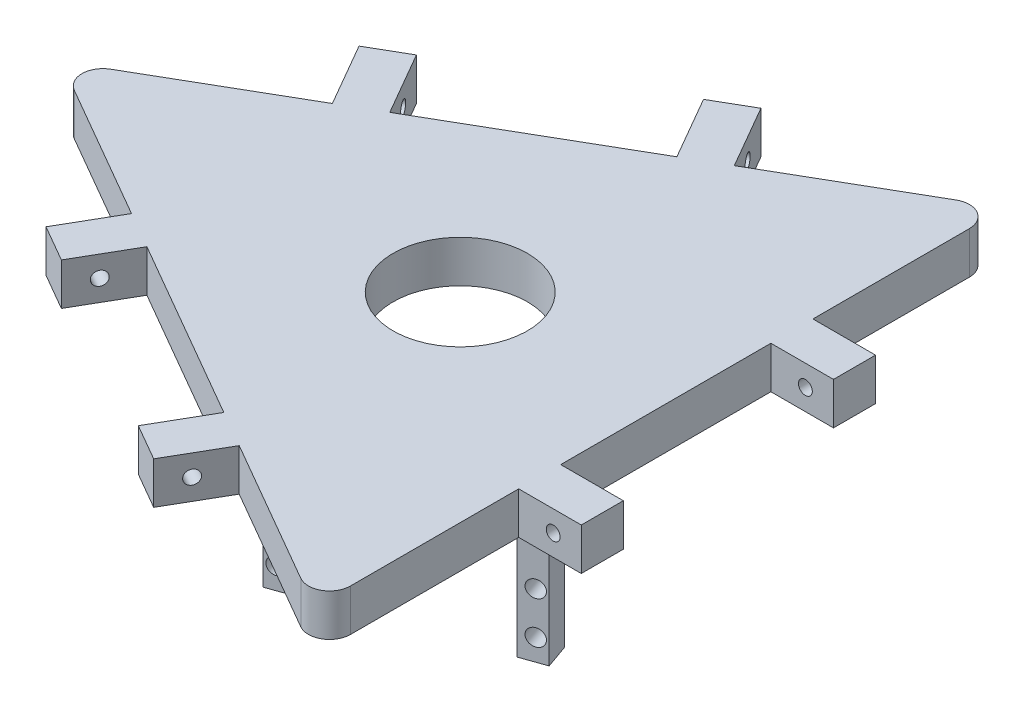
from build123d import *

# Parameters (mm, degrees)
BOSS_EXTRUDE1_DEPTH               = 10
BOSS_EXTRUDE3_DEPTH               = 10
TAP_DRILL_FOR_M4_TAP1_D           = 3.3
TAP_DRILL_FOR_M4_TAP1_CSINK_D     = 3.35
TAP_DRILL_FOR_M4_TAP1_CSINK_ANGLE = 90
CIRPATTERN1_OUTLINE_W             = 0.025
CIRPATTERN1_OUTLINE_H             = 10
CIRPATTERN1_START                 = -36.401802592
CIRPATTERN1_2_OUTLINE_W           = 14.892514764
CIRPATTERN1_2_OUTLINE_H           = 10
CIRPATTERN1_2_OUTLINE_R           = 1.675
CIRPATTERN1_2_DEPTH               = 10
CIRPATTERN1_START_2               = 23.598197408
CIRPATTERN1_3_OUTLINE_W           = 14.892514764
CIRPATTERN1_3_OUTLINE_H           = 10
CIRPATTERN1_3_OUTLINE_R           = 1.675
CIRPATTERN1_3_DEPTH               = 10
CIRPATTERN1_4_OUTLINE_R           = 1.675
CIRPATTERN1_4_DEPTH               = 1.140104786
CIRPATTERN1_5_OUTLINE_W           = 14.892514764
CIRPATTERN1_5_OUTLINE_H           = 10
CIRPATTERN1_5_OUTLINE_R           = 1.65
CIRPATTERN1_5_DEPTH               = 10
CIRPATTERN1_6_OUTLINE_W           = 14.892514764
CIRPATTERN1_6_OUTLINE_H           = 10
CIRPATTERN1_6_OUTLINE_R           = 1.65
CIRPATTERN1_6_DEPTH               = 10
SKETCH13_R                        = 15.980929879
CUT_EXTRUDE1_DEPTH                = 120.91610231
BOSS_EXTRUDE4_DEPTH               = 29
SKETCH16_R                        = 2
CUT_EXTRUDE2_DEPTH                = 6
SKETCH17_R                        = 2
CUT_EXTRUDE3_DEPTH                = 6


with BuildPart() as part:
    # Sketch2 → Boss-Extrude1 (new body)
    with BuildSketch(Plane(origin=(0, 0, 0), x_dir=(0, 0, -1), z_dir=(0, 1, 0))):
        with BuildLine():
            Line((-58.63620668, -6.560889132), (-77.942286341, -40))
            ThreePointArc((-77.942286341, -40), (-77.942286341, -45), (-73.612159322, -47.5))
            Line((-73.612159322, -47.5), (-35, -47.5))
            Line((-35, -47.5), (-25, -47.5))
            Line((-25, -47.5), (25, -47.5))
            Line((25, -47.5), (35, -47.5))
            Line((35, -47.5), (73.612159322, -47.5))
            ThreePointArc((73.612159322, -47.5), (77.942286341, -45), (77.942286341, -40))
            Line((77.942286341, -40), (58.63620668, -6.560889132))
            Line((58.63620668, -6.560889132), (53.63620668, 2.099364905))
            Line((53.63620668, 2.099364905), (28.63620668, 45.400635095))
            Line((28.63620668, 45.400635095), (23.63620668, 54.060889132))
            Line((23.63620668, 54.060889132), (4.330127019, 87.5))
            ThreePointArc((4.330127019, 87.5), (0, 90), (-4.330127019, 87.5))
            Line((-4.330127019, 87.5), (-23.63620668, 54.060889132))
            Line((-23.63620668, 54.060889132), (-28.63620668, 45.400635095))
            Line((-28.63620668, 45.400635095), (-53.63620668, 2.099364905))
            Line((-53.63620668, 2.099364905), (-58.63620668, -6.560889132))
        make_face()
    extrude(amount=BOSS_EXTRUDE1_DEPTH)

    # Sketch2<7> → Boss-Extrude3 (add)
    with BuildSketch(Plane(origin=(0, 0, 0), x_dir=(0, 0, -1), z_dir=(0, 1, 0))):
        Polygon((58.63620668, -6.560889132), (53.63620668, 2.099364905), (68.63620668, 10.759618943), (73.63620668, 2.099364905), align=None)
        Polygon((23.63620668, 54.060889132), (38.63620668, 62.72114317), (43.63620668, 54.060889132), (28.63620668, 45.400635095), align=None)
    extrude(amount=BOSS_EXTRUDE3_DEPTH)

    # Tap Drill for M4 Tap1 (through all)
    with Locations(Plane(origin=(-30.310889132, 0, 17.5), x_dir=(0.49999999999999517, 0, 0.8660254037844415), z_dir=(-0.8660254037844414, 0, 0.4999999999999951))):
        with Locations((-56.160254038, 5)):
            CounterSinkHole(TAP_DRILL_FOR_M4_TAP1_D / 2, TAP_DRILL_FOR_M4_TAP1_CSINK_D / 2, counter_sink_angle=TAP_DRILL_FOR_M4_TAP1_CSINK_ANGLE)



with BuildPart() as body_2:
    # CirPattern1: read off the stored shape, not the designer's step
    # CirPattern1 outline → CirPattern1 (revolve)
    with BuildSketch(Plane(origin=(55.706980142, 5, 0), x_dir=(1, 0, 0), z_dir=(0, -1, 0))):
        with Locations((1.6625, 28.598197408)):
            Rectangle(CIRPATTERN1_OUTLINE_W, CIRPATTERN1_OUTLINE_H)
        Polygon((1.675, -26.401802592), (1.65, -26.401802592), (1.65, -35.236697806), (1.675, -35.261697806), align=None)
    revolve(axis=Axis((55.706980142, 5, 0), (0, 0, 1)))


with BuildPart() as part_1:
    add(part.part)

    add(body_2.part)  # CirPattern1 2 merges body 2
    # CirPattern1 2 outline → CirPattern1 2 (add)
    with BuildSketch(Plane.XY.offset(CIRPATTERN1_START)):
        with Locations((54.946257382, 5)):
            Rectangle(CIRPATTERN1_2_OUTLINE_W, CIRPATTERN1_2_OUTLINE_H)
        with Locations((55.706980142, 5)):
            Circle(CIRPATTERN1_2_OUTLINE_R, mode=Mode.SUBTRACT)
    extrude(amount=CIRPATTERN1_2_DEPTH)

    # CirPattern1 3 outline → CirPattern1 3 (add)
    with BuildSketch(Plane.XY.offset(CIRPATTERN1_START_2)):
        with Locations((54.946257382, 5)):
            Rectangle(CIRPATTERN1_3_OUTLINE_W, CIRPATTERN1_3_OUTLINE_H)
        with Locations((55.706980142, 5)):
            Circle(CIRPATTERN1_3_OUTLINE_R, mode=Mode.SUBTRACT)
    extrude(amount=CIRPATTERN1_3_DEPTH)

    # CirPattern1 4 outline → CirPattern1 4 (add)
    with BuildSketch(Plane.XY.offset(CIRPATTERN1_START)):
        with Locations((55.706980142, 5)):
            Circle(CIRPATTERN1_4_OUTLINE_R)
    extrude(amount=CIRPATTERN1_4_DEPTH)

    # CirPattern1 5 outline → CirPattern1 5 (add)
    with BuildSketch(Plane(origin=(0, 0, 0), x_dir=(0.500000000000001, 0, -0.866025403784438), z_dir=(0.866025403784438, 0, 0.500000000000001)).offset(CIRPATTERN1_START)):
        with Locations((-54.946257382, 5)):
            Rectangle(CIRPATTERN1_5_OUTLINE_W, CIRPATTERN1_5_OUTLINE_H)
        with Locations((-55.706980142, 5)):
            Circle(CIRPATTERN1_5_OUTLINE_R, mode=Mode.SUBTRACT)
    extrude(amount=CIRPATTERN1_5_DEPTH)

    # CirPattern1 6 outline → CirPattern1 6 (add)
    with BuildSketch(Plane(origin=(0, 0, 0), x_dir=(0.500000000000001, 0, -0.866025403784438), z_dir=(0.866025403784438, 0, 0.500000000000001)).offset(CIRPATTERN1_START_2)):
        with Locations((-54.946257382, 5)):
            Rectangle(CIRPATTERN1_6_OUTLINE_W, CIRPATTERN1_6_OUTLINE_H)
        with Locations((-55.706980142, 5)):
            Circle(CIRPATTERN1_6_OUTLINE_R, mode=Mode.SUBTRACT)
    extrude(amount=CIRPATTERN1_6_DEPTH)

    # Sketch13 → Cut-Extrude1 (cut, through all)
    with BuildSketch(Plane.XZ):
        with Locations(Location((0.00701443, 0.012149349, 0), (0, 0, 270))):
            Circle(SKETCH13_R)
    extrude(amount=-CUT_EXTRUDE1_DEPTH, mode=Mode.SUBTRACT)

    # Sketch15 → Boss-Extrude4 (add)
    with BuildSketch(Plane.XZ):
        Polygon((-3.631756095, 39.600919679), (-3.160458196, 39.433951748), (2.023818696, 37.5973045), (4.027433875, 43.252879291), (-1.628140916, 45.25649447), align=None)
        Polygon((46.137302064, 21.969106104), (46.608599963, 21.802138173), (48.612215142, 27.457712963), (42.956640351, 29.461328142), (40.953025172, 23.805753352), align=None)
    extrude(amount=BOSS_EXTRUDE4_DEPTH)

    # Sketch16 → Cut-Extrude2 (cut)
    with BuildSketch(Plane(origin=(12.06005593, 0, 34.041740653), x_dir=(-0.9425957984699193, 0, 0.3339358631636553), z_dir=(-0.33393586316365526, 0, -0.9425957984699191))):
        with Locations((-34.152554668, -23.871092604)):
            Circle(SKETCH16_R)
        with Locations((-34.152554668, -13.871092604)):
            Circle(SKETCH16_R)
    extrude(amount=-CUT_EXTRUDE2_DEPTH, mode=Mode.SUBTRACT)

    # Sketch17 → Cut-Extrude3 (cut)
    with BuildSketch(Plane(origin=(12.06005593, 0, 34.041740653), x_dir=(-0.9425957984699224, 0, 0.33393586316364626), z_dir=(-0.33393586316364626, 0, -0.9425957984699224))):
        with Locations((14.147445332, -23.871092604)):
            Circle(SKETCH17_R)
        with Locations((14.147445332, -13.871092604)):
            Circle(SKETCH17_R)
    extrude(amount=-CUT_EXTRUDE3_DEPTH, mode=Mode.SUBTRACT)


solid = part_1.part
